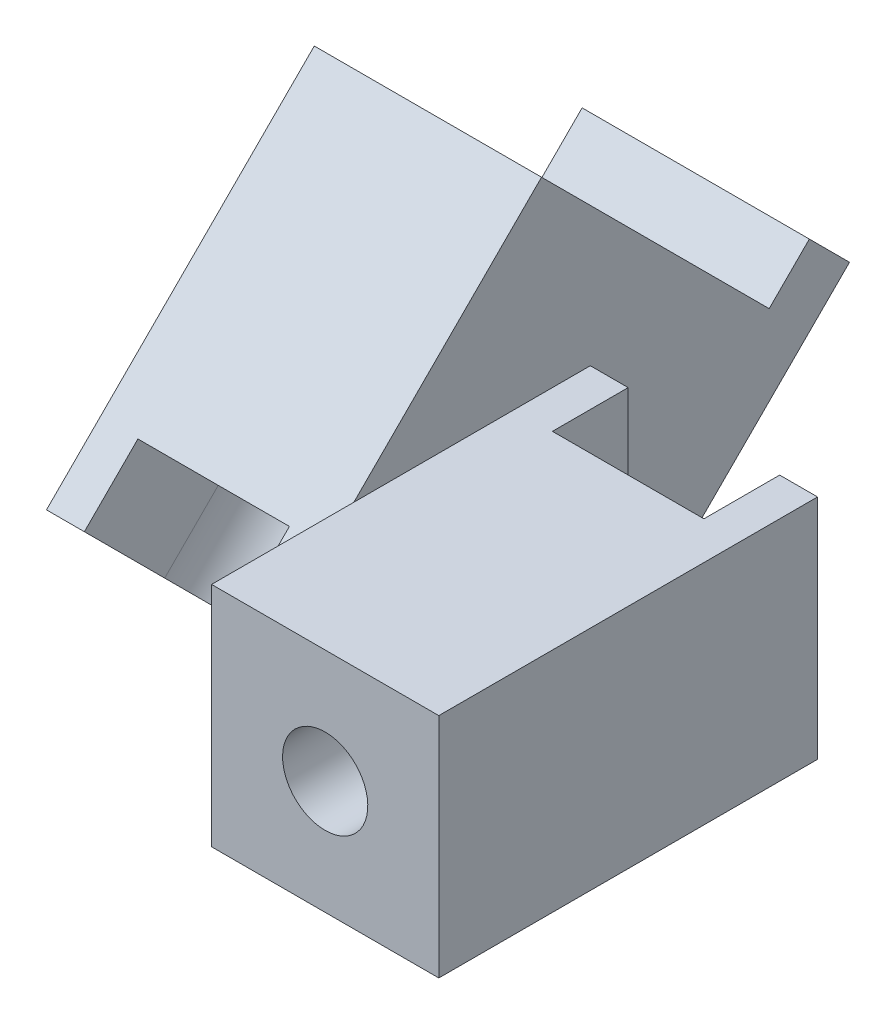
from build123d import *

# Parameters (mm, degrees)
FRAME_BODY_EXT_DEPTH                  = 6
FRAME_BODY_EXT_DEPTH_BACK             = 6
SKETCH6_R                             = 2.25
FRAME_BOLT_CUT_DEPTH                  = 26.13961018
SKETCH9_W                             = 12
SKETCH9_H                             = 12
CASE_BODY_EXT_DEPTH                   = 20
SKETCH10_R                            = 2.25
CASE_BOLT_CUT_DEPTH                   = 39.721912961
PRINT_PLANE_CUT_REACH                 = 31.479
SKETCH11_R                            = 4
CASE_COUNTERBORE_CUT_DEPTH            = 4
SKETCH7_R                             = 4
FRAME_COUNTERBORE_CUT_DEPTH           = 4
FRAME_COUNTERBORE_EXTENSION_CUT_DEPTH = 4
CASE_COUNTERBORE_EXTENSION_CUT_DEPTH  = 4
ROTATION_ONTO_PRINT_PLANE_ANGLE       = 45


with BuildPart() as part:
    # Sketch5 → Frame Body Ext (new, two sides: drawn at the far end of the back side and taken through both)
    with BuildSketch(Plane.ZY.offset(-FRAME_BODY_EXT_DEPTH_BACK)):
        Polygon((-20, 6), (-20, -11), (-23, -11), (-23, -14), (0, -14), (0, 6), align=None)
    extrude(amount=FRAME_BODY_EXT_DEPTH + FRAME_BODY_EXT_DEPTH_BACK)

    # Sketch6 → Frame Bolt Cut (cut, through all)
    with BuildSketch(Plane(origin=(0, 0, -20), x_dir=(-1, 0, 0), z_dir=(0, 0, -1))):
        Circle(SKETCH6_R)
    extrude(amount=-FRAME_BOLT_CUT_DEPTH, mode=Mode.SUBTRACT)

    # Sketch9 → Case Body Ext (add)
    with BuildSketch(Plane(origin=(12, 7.071067812, 3.571067812), x_dir=(-1, 0, 0), z_dir=(0, -0.7071067811865486, -0.7071067811865465))):
        Rectangle(SKETCH9_W, SKETCH9_H)
    extrude(amount=CASE_BODY_EXT_DEPTH)

    # Sketch10 → Case Bolt Cut (cut, through all)
    with BuildSketch(Plane(origin=(0, 5.321067812, 5.321067812), x_dir=(1, 0, 0), z_dir=(0, 0.7071067811865487, 0.7071067811865465))):
        with Locations(Location((12, 2.474873734, 0), (0, 0, 270))):
            Circle(SKETCH10_R)
    extrude(amount=-CASE_BOLT_CUT_DEPTH, mode=Mode.SUBTRACT)

    # Sketch14 → Print Plane Cut (cut, up to next)
    with BuildSketch(Plane(origin=(6, 0, 0), x_dir=(0, 0, -1), z_dir=(1, 0, 0)), mode=Mode.PRIVATE) as print_plane_cut_sk1:
        Polygon((0, -4.985281374), (9.014718626, -14), (0, -14), align=None)
    print_plane_cut_tool1 = extrude(print_plane_cut_sk1.sketch, amount=-PRINT_PLANE_CUT_REACH, mode=Mode.PRIVATE) & part.part
    add(print_plane_cut_tool1.solids().sort_by_distance((6, -10.995094, -3.004906))[0], mode=Mode.SUBTRACT)

    # Sketch11 → Case Counterbore Cut (cut)
    with BuildSketch(Plane(origin=(0, -8.821067812, -8.821067812), x_dir=(1, 0, 0), z_dir=(0, -0.7071067811865487, -0.7071067811865465))):
        with Locations(Location((12, -2.474873734, 0), (0, 0, 270))):
            Circle(SKETCH11_R)
    extrude(amount=-CASE_COUNTERBORE_CUT_DEPTH, mode=Mode.SUBTRACT)

    # Sketch7 → Frame Counterbore Cut (cut)
    with BuildSketch(Plane.XY):
        Circle(SKETCH7_R)
    extrude(amount=-FRAME_COUNTERBORE_CUT_DEPTH, mode=Mode.SUBTRACT)

    # Sketch15 → Frame Counterbore Extension Cut (cut)
    with BuildSketch(Plane.XY):
        with BuildLine():
            Line((-4, 0), (-4, 6))
            Line((-4, 6), (4, 6))
            Line((4, 6), (4, 0))
            ThreePointArc((4, 0), (0, 4), (-4, 0))
        make_face()
    extrude(amount=-FRAME_COUNTERBORE_EXTENSION_CUT_DEPTH, mode=Mode.SUBTRACT)

    # Sketch16 → Case Counterbore Extension Cut (cut)
    with BuildSketch(Plane(origin=(0, -8.821067812, -8.821067812), x_dir=(1, 0, 0), z_dir=(0, -0.7071067811865486, -0.7071067811865465))):
        with BuildLine():
            Line((16, -8.474873734), (16, -2.474873734))
            ThreePointArc((16, -2.474873734), (12, -6.474873734), (8, -2.474873734))
            Line((8, -2.474873734), (8, -8.474873734))
            Line((8, -8.474873734), (16, -8.474873734))
        make_face()
    extrude(amount=-CASE_COUNTERBORE_EXTENSION_CUT_DEPTH, mode=Mode.SUBTRACT)


with BuildPart() as part_1:
    # Rotation onto Print Plane: read off the stored shape, not the designer's step
    # Rotation onto Print Plane: moved
    add(part.part.moved(Location((0, 6.8388348, 1.8535534))).rotate(Axis((0, 0, 0), (1, 0, 0)), ROTATION_ONTO_PRINT_PLANE_ANGLE))


solid = part_1.part
